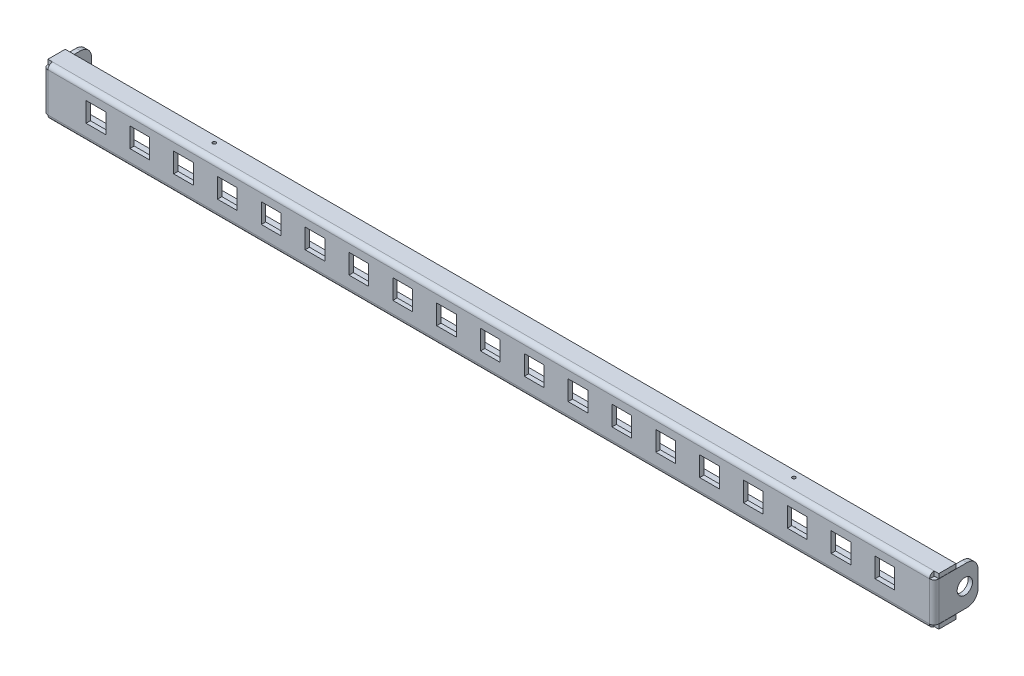
from build123d import *

# Parameters (mm, degrees)
SKETCH_1_W                         = 406.5
SKETCH_1_H                         = 22
SM_BASE_FLANGE_1_DEPTH             = 2
SM_EDGE_FLANGE_1_STRIP_W           = 8.2
SM_EDGE_FLANGE_1_STRIP_H           = 2
SM_EDGE_FLANGE_1_STRIP_CUT_DEPTH   = 406.5
SM_EDGE_FLANGE_1_STRIP_2_W         = 8.2
SM_EDGE_FLANGE_1_STRIP_2_H         = 2
SM_EDGE_FLANGE_1_STRIP_CUT_2_DEPTH = 406.5
SM_EDGE_FLANGE_1_DEPTH             = 406.5
SM_EDGE_FLANGE_1_BEND_DEPTH        = 406.5
SM_START                           = -11
SM_EDGE_FLANGE_2_DEPTH             = 22
SM_EDGE_FLANGE_2_2_DEPTH           = 2.1
SM_START_2                         = 8.9
SM_EDGE_FLANGE_2_3_DEPTH           = 2.1
SM_START_3                         = -8.9
SM_EDGE_FLANGE_2_4_DEPTH           = 17.8
SKETCH_18_W                        = 9
SKETCH_18_H                        = 9
CUT_EXTRUDE_1_DEPTH                = 10
PATTERN_LINEAR_1_COUNT             = 19
PATTERN_LINEAR_1_PITCH             = 20
FILLET_1_R                         = 5
SKETCH_19_R                        = 3.5
CUT_EXTRUDE_2_DEPTH                = 408.140332072
CUT_EXTRUDE_3_DEPTH                = 206.413150747
CUT_EXTRUDE_3_DEPTH_BACK           = 206.413150747
SKETCH_20_R                        = 0.75


# Read off the part's stored shape, not the designer's step: 边线-法兰2
# Sheet-metal steps are written as plain solids
with BuildPart() as part:
    # Sketch 1 → 基体-法兰1 (new body)
    with BuildSketch(Plane.XY):
        Rectangle(SKETCH_1_W, SKETCH_1_H)
    extrude(amount=-SM_BASE_FLANGE_1_DEPTH)

    # 边线-法兰1 strip (across the edge) → 边线-法兰1 strip cut (cut)
    with BuildSketch(Plane(origin=(203.25, -11, -2), x_dir=(0, 1, 0), z_dir=(-1, 0, 0))):
        with Locations((-2, -1)):
            Rectangle(SM_EDGE_FLANGE_1_STRIP_W, SM_EDGE_FLANGE_1_STRIP_H)
    extrude(amount=SM_EDGE_FLANGE_1_STRIP_CUT_DEPTH, mode=Mode.SUBTRACT)

    # 边线-法兰1 strip 2 (across the edge) → 边线-法兰1 strip cut 2 (cut)
    with BuildSketch(Plane(origin=(-203.25, 11, -2), x_dir=(0, -1, 0), z_dir=(1, 0, 0))):
        with Locations((-2, -1)):
            Rectangle(SM_EDGE_FLANGE_1_STRIP_2_W, SM_EDGE_FLANGE_1_STRIP_2_H)
    extrude(amount=SM_EDGE_FLANGE_1_STRIP_CUT_2_DEPTH, mode=Mode.SUBTRACT)

    # 边线-法兰1 section (across the edge) → 边线-法兰1 (add)
    with BuildSketch(Plane(origin=(203.25, -11, -2), x_dir=(0, 1, 0), z_dir=(-1, 0, 0))):
        with BuildLine():
            Line((0, 0.1), (0, 8))
            Line((0, 8), (2, 8))
            Line((2, 8), (2, 0.1))
            ThreePointArc((2, 0.1), (2.029289322, 0.029289322), (2.1, 0))
            Line((2.1, 0), (2.1, -2))
            ThreePointArc((2.1, -2), (0.61507576, -1.38492424), (0, 0.1))
        make_face()
    extrude(amount=SM_EDGE_FLANGE_1_DEPTH)

    # 边线-法兰1 section 2 (across the edge) → 边线-法兰1 bend (add)
    with BuildSketch(Plane(origin=(-203.25, 11, -2), x_dir=(0, -1, 0), z_dir=(1, 0, 0))):
        with BuildLine():
            Line((0, 0.1), (0, 8))
            Line((0, 8), (2, 8))
            Line((2, 8), (2, 0.1))
            ThreePointArc((2, 0.1), (2.029289322, 0.029289322), (2.1, 0))
            Line((2.1, 0), (2.1, -2))
            ThreePointArc((2.1, -2), (0.61507576, -1.38492424), (0, 0.1))
        make_face()
    extrude(amount=SM_EDGE_FLANGE_1_BEND_DEPTH)

    # 边线-法兰2 outline → 边线-法兰2 (cut)
    with BuildSketch(Plane(origin=(0, 0, 0), x_dir=(1, 0, 0), z_dir=(0, 1, 0)).offset(SM_START)):
        with BuildLine():
            Line((201.25, 2.1), (201.15, 2.1))
            Line((201.15, 2.1), (201.15, 2))
            ThreePointArc((201.15, 2), (201.220710678, 2.029289322), (201.25, 2.1))
        make_face()
        with BuildLine():
            ThreePointArc((203.25, 2.1), (202.63492424, 0.61507576), (201.15, 0))
            Line((201.15, 0), (203.25, 0))
            Line((203.25, 0), (203.25, 2.1))
        make_face()
        with BuildLine():
            ThreePointArc((-201.25, 2.1), (-201.220710678, 2.029289322), (-201.15, 2))
            Line((-201.15, 2), (-201.15, 2.1))
            Line((-201.15, 2.1), (-201.25, 2.1))
        make_face()
        with BuildLine():
            Line((-203.25, 0), (-201.15, 0))
            ThreePointArc((-201.15, 0), (-202.63492424, 0.61507576), (-203.25, 2.1))
            Line((-203.25, 2.1), (-203.25, 0))
        make_face()
    extrude(amount=SM_EDGE_FLANGE_2_DEPTH, mode=Mode.SUBTRACT)

    # Sm Edge Flange 2 2 outline → Sm Edge Flange 2 2 (cut)
    with BuildSketch(Plane(origin=(0, 0, 0), x_dir=(1, 0, 0), z_dir=(0, 1, 0)).offset(SM_START)):
        with BuildLine():
            Line((203.25, 2.1), (201.25, 2.1))
            ThreePointArc((201.25, 2.1), (201.220710678, 2.029289322), (201.15, 2))
            Line((201.15, 2), (201.15, 0))
            ThreePointArc((201.15, 0), (202.63492424, 0.61507576), (203.25, 2.1))
        make_face()
        with BuildLine():
            ThreePointArc((-203.25, 2.1), (-202.63492424, 0.61507576), (-201.15, 0))
            Line((-201.15, 0), (-201.15, 2))
            ThreePointArc((-201.15, 2), (-201.220710678, 2.029289322), (-201.25, 2.1))
            Line((-201.25, 2.1), (-203.25, 2.1))
        make_face()
    extrude(amount=SM_EDGE_FLANGE_2_2_DEPTH, mode=Mode.SUBTRACT)

    # Sm Edge Flange 2 3 outline → Sm Edge Flange 2 3 (cut)
    with BuildSketch(Plane(origin=(0, 0, 0), x_dir=(1, 0, 0), z_dir=(0, 1, 0)).offset(SM_START_2)):
        with BuildLine():
            Line((203.25, 2.1), (201.25, 2.1))
            ThreePointArc((201.25, 2.1), (201.220710678, 2.029289322), (201.15, 2))
            Line((201.15, 2), (201.15, 0))
            ThreePointArc((201.15, 0), (202.63492424, 0.61507576), (203.25, 2.1))
        make_face()
        with BuildLine():
            ThreePointArc((-203.25, 2.1), (-202.63492424, 0.61507576), (-201.15, 0))
            Line((-201.15, 0), (-201.15, 2))
            ThreePointArc((-201.15, 2), (-201.220710678, 2.029289322), (-201.25, 2.1))
            Line((-201.25, 2.1), (-203.25, 2.1))
        make_face()
    extrude(amount=SM_EDGE_FLANGE_2_3_DEPTH, mode=Mode.SUBTRACT)

    # Sm Edge Flange 2 4 outline → Sm Edge Flange 2 4 (add)
    with BuildSketch(Plane(origin=(0, 0, 0), x_dir=(1, 0, 0), z_dir=(0, 1, 0)).offset(SM_START_3)):
        with BuildLine():
            Line((201.25, 20), (201.25, 2.1))
            ThreePointArc((201.25, 2.1), (201.220710678, 2.029289322), (201.15, 2))
            Line((201.15, 2), (203.247617696, 2))
            ThreePointArc((203.247617696, 2), (203.24940434, 2.049985814), (203.25, 2.1))
            Line((203.25, 2.1), (203.25, 20))
            Line((203.25, 20), (201.25, 20))
        make_face()
        with BuildLine():
            Line((-203.247617696, 2), (-201.15, 2))
            ThreePointArc((-201.15, 2), (-201.220710678, 2.029289322), (-201.25, 2.1))
            Line((-201.25, 2.1), (-201.25, 20))
            Line((-201.25, 20), (-203.25, 20))
            Line((-203.25, 20), (-203.25, 2.1))
            ThreePointArc((-203.25, 2.1), (-203.24940434, 2.049985814), (-203.247617696, 2))
        make_face()
    extrude(amount=SM_EDGE_FLANGE_2_4_DEPTH)

    # 草图18 → 切除-拉伸1 (cut)
    with BuildSketch(Plane.XY):
        with Locations((-179.25, 1)):
            Rectangle(SKETCH_18_W, SKETCH_18_H)
    cut_extrude_1 = extrude(amount=-CUT_EXTRUDE_1_DEPTH, mode=Mode.SUBTRACT)

    # 阵列(线性)1: 切除-拉伸1 ×19
    with Locations(*[(i * PATTERN_LINEAR_1_PITCH, 0, 0) for i in range(1, PATTERN_LINEAR_1_COUNT)]):
        add(cut_extrude_1, mode=Mode.SUBTRACT)

    # 圆角1
    fillet_1_edges = [part.edges().sort_by_distance(p)[0] for p in [
        (-202.25, -8.9, -20),
        (-202.25, 8.9, -20),
        (202.25, 8.9, -20),
        (202.25, -8.9, -20),
    ]]
    fillet(fillet_1_edges, radius=FILLET_1_R)

    # 草图19 → 切除-拉伸2 (cut, through all)
    with BuildSketch(Plane(origin=(203.25, 0, 0), x_dir=(0, 0, -1), z_dir=(1, 0, 0))):
        with Locations((14, 0)):
            Circle(SKETCH_19_R)
    extrude(amount=-CUT_EXTRUDE_2_DEPTH, mode=Mode.SUBTRACT)

    # 草图20 → 切除-拉伸3 (cut, two sides: drawn at the far end of the back side and taken through both)
    with BuildSketch(Plane.XZ.offset(11).offset(-CUT_EXTRUDE_3_DEPTH_BACK)):
        with Locations(Location((132.25, -7, 0), (0, 0, 270))):
            Circle(SKETCH_20_R)
        with Locations(Location((-132.25, -7, 0), (0, 0, 270))):
            Circle(SKETCH_20_R)
    extrude(amount=CUT_EXTRUDE_3_DEPTH + CUT_EXTRUDE_3_DEPTH_BACK, mode=Mode.SUBTRACT)


solid = part.part
